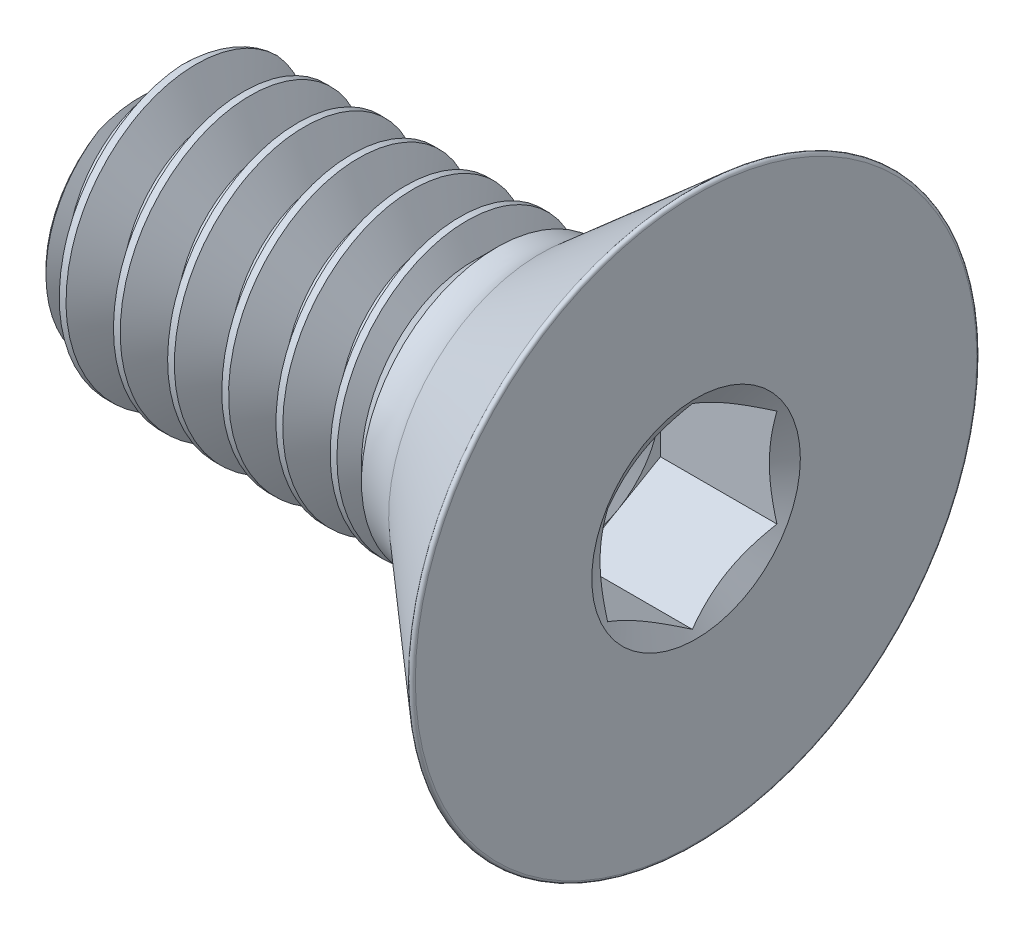
from build123d import *

# Parameters (mm, degrees)
CUT_EXTRUDE1_DEPTH = 2.8194
FILLET1_R          = 0.067818
DELETEFACE1_START  = 1
DELETEFACE1_DEPTH  = 2.5306
CUT_SWEEP1_PITCH   = 1.27
CUT_SWEEP1_TO      = 8.02986


with BuildPart() as part:
    # Sketch3 → Revolve1 (revolve)
    with BuildSketch(Plane.XY, mode=Mode.PRIVATE) as revolve1_sk:
        with BuildLine():
            Line((-5.715, 3.175), (-6.35, 2.54))
            Line((-6.35, 2.54), (-6.35, 0))
            Line((-6.35, 0), (6.35, 0))
            Line((6.35, 0), (6.35, 6.729861186))
            Line((6.35, 6.729861186), (2.698890363, 3.556))
            ThreePointArc((2.698890363, 3.556), (2.22382298, 3.273364608), (1.679859574, 3.175))
            Line((1.679859574, 3.175), (-5.715, 3.175))
        make_face()
    revolve(revolve1_sk.sketch.rotate(Axis((6.35, 0, 0), (-1, 0, 0)), 90), axis=Axis((6.35, 0, 0), (-1, 0, 0)))

    # Sketch4 → Cut-Extrude1 (cut)
    with BuildSketch(Plane(origin=(6.35, 0, 0), x_dir=(0, 0, -1), z_dir=(1, 0, 0))):
        Polygon((0, 2.291358881), (-1.984375, 1.14567944), (-1.984375, -1.14567944), (0, -2.291358881), (1.984375, -1.14567944), (1.984375, 1.14567944), align=None)
    extrude(amount=-CUT_EXTRUDE1_DEPTH, mode=Mode.SUBTRACT)

    # Cut-Extrude2 cone 1 section (through the dimple's axis) → Cut-Extrude2 (revolve, cut)
    with BuildSketch(Plane(origin=(6.35, 0, 0), x_dir=(0, 0, -1), z_dir=(0, 1, 0))):
        Polygon((0, 0), (2.444850821, 0), (0, 1.41153528), align=None)
    revolve(axis=Axis((6.35, 0, 0), (-1, 0, 0)), mode=Mode.SUBTRACT)

    # Cut-Extrude3 cone 1 section (through the dimple's axis) → Cut-Extrude3 (revolve, cut)
    with BuildSketch(Plane(origin=(3.5306, 0, 0), x_dir=(0, 0, -1), z_dir=(0, 1, 0))):
        Polygon((0, 0), (1.984375, 0), (0, 1.14567944), align=None)
    revolve(axis=Axis((3.5306, 0, 0), (-1, 0, 0)), mode=Mode.SUBTRACT)

    # Fillet1
    fillet1_edges = [part.edges().sort_by_distance(p)[0] for p in [
        (6.35, 0, 6.729861186),
    ]]
    fillet(fillet1_edges, radius=FILLET1_R)

    # DeleteFace1: read off the stored shape, not the designer's step
    # DeleteFace1 outline → DeleteFace1 (add)
    with BuildSketch(Plane.YZ.offset(DELETEFACE1_START)):
        Polygon((-1.14567944, -1.984375), (1.14567944, -1.984375), (2.291358881, 0), (1.14567944, 1.984375), (-1.14567944, 1.984375), (-2.291358881, 0), align=None)
    extrude(amount=DELETEFACE1_DEPTH)


with BuildPart() as body_2:
    # Split1: the piece on the far side of the plane
    add(part.part)
    split(bisect_by=Plane(origin=(1.679859574, 0, 0), x_dir=(0, 0, 1), z_dir=(1, 0, 0)), keep=Keep.BOTTOM)

    # Cut-Sweep1: arcs per turn and ends read off the stored shape
    # Cut-Sweep1: the profile of Sketch7 screwed along a right-hand helix through 10 turns, 8 arcs to a turn; built about Z, then put on its axis
    cut_sweep1_z = Axis((0, 0, 0), (0, 0, 1))
    cut_sweep1_corners = [(2.350110803, 0, -0.635), (3.243740766, 0, -1.1509375), (3.243740766, 0, 0.0396875), (2.350110803, 0, -0.47625)]
    with BuildLine(mode=Mode.PRIVATE) as cut_sweep1_profile:
        Line(cut_sweep1_corners[0], cut_sweep1_corners[1])
        Line(cut_sweep1_corners[1], cut_sweep1_corners[2])
        Line(cut_sweep1_corners[2], cut_sweep1_corners[3])
        Line(cut_sweep1_corners[3], cut_sweep1_corners[0])
    cut_sweep1_cap = Face(cut_sweep1_profile.wire())
    cut_sweep1_turn_angles = [0, 22.5, 45, 67.5, 90, 112.5, 135, 157.5, 180, 202.5, 225, 247.5, 270, 292.5, 315, 337.5, 360]
    cut_sweep1_turn_weights = [1, 0.9238795325112867, 1, 0.9238795325112867, 1, 0.9238795325112867, 1, 0.9238795325112867, 1, 0.9238795325112867, 1, 0.9238795325112867, 1, 0.9238795325112867, 1, 0.9238795325112867, 1]
    cut_sweep1_turn_rails = [Edge.make_bspline([Vector(p[0], p[1], 0).rotate(cut_sweep1_z, cut_sweep1_turn_angles[k]) / cut_sweep1_turn_weights[k] + Vector(0, 0, p[2] + CUT_SWEEP1_PITCH * cut_sweep1_turn_angles[k] / 360) for k in range(17)], [0, 0, 0, 1, 1, 2, 2, 3, 3, 4, 4, 5, 5, 6, 6, 7, 7, 8, 8, 8], 2, cut_sweep1_turn_weights) for p in cut_sweep1_corners]
    cut_sweep1_turn_sides = [Face.make_surface_from_curves(cut_sweep1_turn_rails[p[0]], cut_sweep1_turn_rails[p[1]]) for p in [(0, 1), (1, 2), (2, 3), (3, 0)]]
    cut_sweep1 = Plane(origin=(-6.35, 0, 0), x_dir=(0, -1, 0), z_dir=(1, 0, 0)) * split(Solid(Shell([*[p.moved(Location((0, 0, CUT_SWEEP1_PITCH * i))) for i in range(10) for p in cut_sweep1_turn_sides], cut_sweep1_cap, cut_sweep1_cap.rotate(cut_sweep1_z, 3600).moved(Location((0, 0, CUT_SWEEP1_PITCH * 3600 / 360)))])), bisect_by=Plane.XY.offset(CUT_SWEEP1_TO), keep=Keep.BOTTOM, mode=Mode.PRIVATE)
    add(cut_sweep1, mode=Mode.SUBTRACT)


with BuildPart() as part_1:
    add(part.part)

    # Split1
    split(bisect_by=Plane(origin=(1.679859574, 0, 0), x_dir=(0, 0, 1), z_dir=(1, 0, 0)), keep=Keep.TOP)

    add(body_2.part)  # Revolve2 merges body 2
    # Sketch9 → Revolve2 (revolve)
    with BuildSketch(Plane.XY, mode=Mode.PRIVATE) as revolve2_sk:
        with BuildLine():
            Line((1.679859574, 3.175), (1.679859574, 0))
            Line((1.679859574, 0), (2.698890363, 0))
            Line((2.698890363, 0), (2.698890363, 3.556))
            ThreePointArc((2.698890363, 3.556), (2.22382298, 3.273364608), (1.679859574, 3.175))
        make_face()
    revolve(revolve2_sk.sketch.rotate(Axis((1.679859574, 0, 0), (1, 0, 0)), 296.089139424), axis=Axis((1.679859574, 0, 0), (1, 0, 0)))

    # Cut-Extrude4 cone 1 section (through the dimple's axis) → Cut-Extrude4 (revolve, cut)
    with BuildSketch(Plane(origin=(3.5306, 0, 0), x_dir=(0, 0, -1), z_dir=(0, 1, 0))):
        Polygon((0, 0), (1.984375, 0), (0, 1.14567944), align=None)
    revolve(axis=Axis((3.5306, 0, 0), (-1, 0, 0)), mode=Mode.SUBTRACT)

    # Boss-Extrude1: read off the stored shape, not the designer's step
    # Boss-Extrude1 outline → Boss-Extrude1 (revolve)
    with BuildSketch(Plane.YX):
        Polygon((2.350104501, 1.679859574), (2.350104501, 0.854964075), (3.175, 1.679859574), align=None)
    revolve(axis=Axis((0, 0, 0), (1, 0, 0)))


solid = part_1.part
